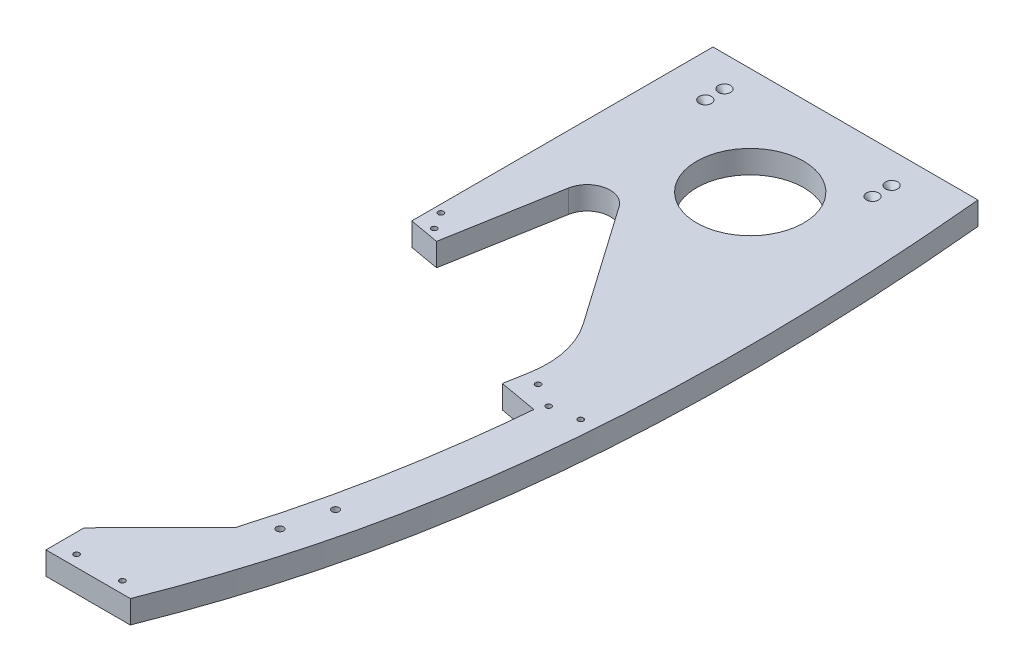
from build123d import *

# Parameters (mm, degrees)
STOCK_LEFT_START                     = 6602.1458
STOCK_LEFT_CONSOLE_1_OUTLINE_R       = 2.286
STOCK_LEFT_CONSOLE_1_OUTLINE_R_2     = 44.45
STOCK_LEFT_CONSOLE_1_DEPTH           = 19.05
SKETCH1_R                            = 2.286
BOSS_EXTRUDE1_DEPTH                  = 19.05
F_5_64_0_07813_DIAMETER_HOLE1_D      = 1.984502
F_5_64_0_07813_DIAMETER_HOLE1_DEPTH  = 38.1
F_5_64_0_07813_DIAMETER_HOLE1_TIP    = 0.59620455
HOLE1_D                              = 1.98374
HOLE1_DEPTH                          = 19.05
HOLE1_CSINK_D                        = 10.16
HOLE1_CSINK_ANGLE                    = 82
HOLE1_TIP                            = 0.595975622
F_15_64_0_23438_DIAMETER_HOLE1_D     = 5.953252
F_15_64_0_23438_DIAMETER_HOLE1_DEPTH = 12.7
F_15_64_0_23438_DIAMETER_HOLE1_TIP   = 1.788537341
F_15_64_0_23438_DIAMETER_HOLE2_D     = 5.953252


# Read off the part's stored shape, not the designer's step: Stock-Left Console-1
with BuildPart() as part:
    # Stock-Left Console-1 outline → Stock-Left Console-1 (new body)
    with BuildSketch(Plane(origin=(0, 0, 0), x_dir=(1, 0, 0), z_dir=(0, 1, 0)).offset(STOCK_LEFT_START)):
        with BuildLine():
            Line((357.802906487, -3322.246193472), (427.81043067, -3322.246195127))
            add(Edge.make_bspline(
                [(427.81043067, -3322.246195127), (473.388143546, -3207.192047458), (498.434160064, -3084.558176537), (504.840097902, -2846.856520671), (500.419755279, -2759.632030412), (493.181235291, -2683.510000386)],
                knots=[-62.01580073, -62.01580073, -62.01580073, -62.01580073, -27.97842461, -27.97842461, -9.154068647, -9.154068647, -9.154068647, -9.154068647], degree=3))
            Line((493.181235291, -2683.510000386), (273.05, -2683.510000011))
            Line((273.05, -2683.510000011), (273.05, -2933.697739453))
            Line((273.05, -2933.697739453), (298.063657014, -2938.111010516))
            Line((298.063657014, -2938.111010516), (314.509168719, -2844.900694709))
            ThreePointArc((314.509168719, -2844.900694709), (329.148175534, -2829.611779383), (348.875396841, -2837.285643591))
            Line((348.875396841, -2837.285643591), (418.46673346, -2936.69442468))
            ThreePointArc((418.46673346, -2936.69442468), (430.437407433, -2963.905621235), (431.085143003, -2993.626433673))
            Line((431.085143003, -2993.626433673), (427.658008361, -3013.062680059))
            Line((427.658008361, -3013.062680059), (459.43413222, -3018.669083307))
            add(Edge.make_bspline(
                [(459.43413222, -3018.669083307), (456.223775647, -3054.466127933), (451.650547457, -3088.445708947), (445.737069512, -3121.041687467), (439.008868755, -3158.128540481), (430.553849402, -3193.432616991), (420.351653238, -3227.631207238)],
                knots=[34.96272562, 34.96272562, 34.96272562, 34.96272562, 43.828946319, 43.828946319, 43.828946319, 53.916700663, 53.916700663, 53.916700663, 53.916700663], degree=3))
            Line((420.351653238, -3227.631207238), (357.739033333, -3290.49625772))
            Line((357.739033333, -3290.49625772), (357.802906487, -3322.246193472))
        make_face()
        with Locations((373.658776627, -3312.721193497)):
            Circle(STOCK_LEFT_CONSOLE_1_OUTLINE_R, mode=Mode.SUBTRACT)
        with Locations((411.758776627, -3312.721193478)):
            Circle(STOCK_LEFT_CONSOLE_1_OUTLINE_R, mode=Mode.SUBTRACT)
        with Locations((463.209250621, -3010.106955909)):
            Circle(STOCK_LEFT_CONSOLE_1_OUTLINE_R, mode=Mode.SUBTRACT)
        with Locations((486.003084481, -3006.374869262)):
            Circle(STOCK_LEFT_CONSOLE_1_OUTLINE_R, mode=Mode.SUBTRACT)
        with Locations((287.824193289, -2929.856338812)):
            Circle(STOCK_LEFT_CONSOLE_1_OUTLINE_R, mode=Mode.SUBTRACT)
        with Locations((279.4, -2915.847898591)):
            Circle(STOCK_LEFT_CONSOLE_1_OUTLINE_R, mode=Mode.SUBTRACT)
        with Locations((292.1, -2727.960000043)):
            Circle(STOCK_LEFT_CONSOLE_1_OUTLINE_R, mode=Mode.SUBTRACT)
        with Locations((292.1, -2702.559999968)):
            Circle(STOCK_LEFT_CONSOLE_1_OUTLINE_R, mode=Mode.SUBTRACT)
        with Locations((317.5, -2702.559999968)):
            Circle(STOCK_LEFT_CONSOLE_1_OUTLINE_R, mode=Mode.SUBTRACT)
        with Locations((443.068858037, -2998.799793605)):
            Circle(STOCK_LEFT_CONSOLE_1_OUTLINE_R, mode=Mode.SUBTRACT)
        with Locations((392.883884122, -2772.410060986)):
            Circle(STOCK_LEFT_CONSOLE_1_OUTLINE_R_2, mode=Mode.SUBTRACT)
        with Locations((450.85, -2727.960000048)):
            Circle(STOCK_LEFT_CONSOLE_1_OUTLINE_R, mode=Mode.SUBTRACT)
        with Locations((450.85, -2702.560000048)):
            Circle(STOCK_LEFT_CONSOLE_1_OUTLINE_R, mode=Mode.SUBTRACT)
    extrude(amount=STOCK_LEFT_CONSOLE_1_DEPTH)

    # Sketch1 → Boss-Extrude1 (add)
    with BuildSketch(Plane(origin=(0, 6621.1958, 0), x_dir=(1, 0, 0), z_dir=(0, 1, 0))):
        with Locations((292.1, -2727.959998746)):
            Circle(SKETCH1_R)
        with Locations((292.1, -2702.559998672)):
            Circle(SKETCH1_R)
        with Locations((317.5, -2702.559998672)):
            Circle(SKETCH1_R)
        with Locations((450.85, -2702.559998751)):
            Circle(SKETCH1_R)
        with Locations((450.85, -2727.959998751)):
            Circle(SKETCH1_R)
    extrude(amount=-BOSS_EXTRUDE1_DEPTH)

    # 5/64 (0.07813) Diameter Hole1
    with Locations(Plane(origin=(0, 0, 2664.46), x_dir=(-1, 0, 0), z_dir=(0, 0, -1))):
        with Locations((-481.589248274, 6993.254992531), (-386.339248274, 6993.254992531), (-291.089248274, 6993.254992531), (-295.274999999, 6965.135938475), (-295.274999999, 6812.735938475), (-295.274999999, 6660.335938474), (-285.166362357, 6631.468843414), (-475.477307398, 6631.468752771), (-485.002307398, 6660.335938474), (-485.002307398, 6812.735938474), (-485.002307398, 6965.135938474), (-478.365617646, 6611.6708), (-287.865617646, 6611.6708), (-307.975, 6564.3379), (-307.975, 6488.1379), (-284.960913066, 6440.805), (-380.210913066, 6440.805), (-475.460913066, 6440.805), (-446.831312422, 6488.1379), (-446.831312422, 6564.3379), (-472.231312422, 6396.355), (-472.231312422, 6320.155), (-472.653156211, 6275.705000839), (-377.403156211, 6275.705000839), (-282.153156211, 6275.705000839), (-282.575, 6320.155), (-282.575, 6396.355), (-435.598646187, 6221.729999816), (-435.598646187, 6145.529999816), (-450.592518112, 6091.554999951), (-460.998646187, 6091.555478285), (-460.998646187, 6056.629999944), (-460.998646187, 5980.429999944), (-460.998646187, 5945.505000042), (-282.153156211, 5945.505000042), (-368.611823093, 5945.505000042)):
            Hole(F_5_64_0_07813_DIAMETER_HOLE1_D / 2, depth=F_5_64_0_07813_DIAMETER_HOLE1_DEPTH)
            with Locations((0, 0, -(F_5_64_0_07813_DIAMETER_HOLE1_DEPTH + F_5_64_0_07813_DIAMETER_HOLE1_TIP / 2))):  # 118° drill point
                Cone(0, F_5_64_0_07813_DIAMETER_HOLE1_D / 2, F_5_64_0_07813_DIAMETER_HOLE1_TIP, mode=Mode.SUBTRACT)

    # Hole1
    with Locations(Plane(origin=(0, 6621.1958, 0), x_dir=(1, 0, 0), z_dir=(0, 1, 0))):
        with Locations((307.975, -2724.785), (307.975, -2708.91), (446.831312422, -2724.785), (446.831312422, -2708.91)):
            CounterSinkHole(HOLE1_D / 2, HOLE1_CSINK_D / 2, depth=HOLE1_DEPTH, counter_sink_angle=HOLE1_CSINK_ANGLE)
            with Locations((0, 0, -(HOLE1_DEPTH + HOLE1_TIP / 2))):  # 118° drill point
                Cone(0, HOLE1_D / 2, HOLE1_TIP, mode=Mode.SUBTRACT)

    # 15/64 (0.23438) Diameter Hole1
    with Locations(Plane.ZY.offset(-273.05)):
        with Locations((2746.056935059, 6611.6708), (2871.150804655, 6611.6708)):
            Hole(F_15_64_0_23438_DIAMETER_HOLE1_D / 2, depth=F_15_64_0_23438_DIAMETER_HOLE1_DEPTH)
            with Locations((0, 0, -(F_15_64_0_23438_DIAMETER_HOLE1_DEPTH + F_15_64_0_23438_DIAMETER_HOLE1_TIP / 2))):  # 118° drill point
                Cone(0, F_15_64_0_23438_DIAMETER_HOLE1_D / 2, F_15_64_0_23438_DIAMETER_HOLE1_TIP, mode=Mode.SUBTRACT)

    # 15/64 (0.23438) Diameter Hole2 (through all)
    with Locations(Plane(origin=(0, 6621.1958, 0), x_dir=(1, 0, 0), z_dir=(0, 1, 0))):
        with Locations((439.860441392, -3210.015746304), (449.077665614, -3173.047479133)):
            Hole(F_15_64_0_23438_DIAMETER_HOLE2_D / 2)


solid = part.part
